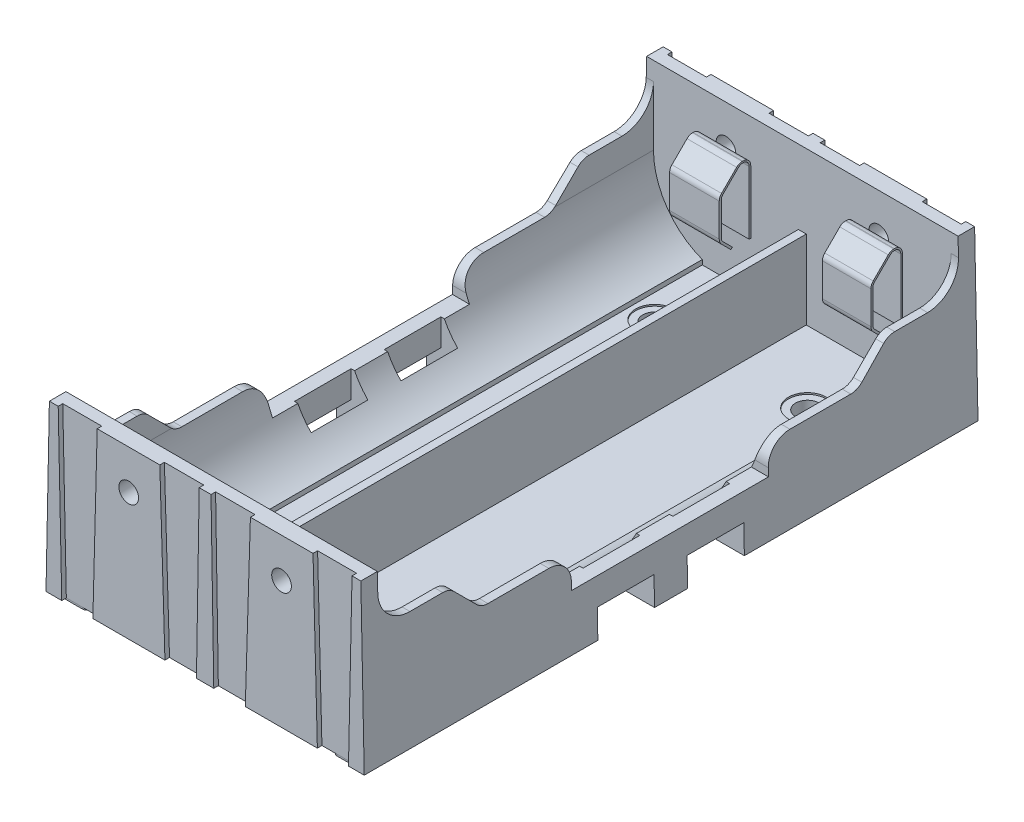
from build123d import *

# Parameters (mm, degrees)
BOSS_EXTRU_1_DEPTH                  = 73.72
BOSS_EXTRU_2_DEPTH                  = 2.1
BOSS_EXTRU_3_DEPTH                  = 2.1
CONG_1_R                            = 4
ENL_V_MAT_EXTRU_1_REACH             = 103.263
ENL_V_START                         = 20
ENL_V_MAT_EXTRU_1_DIRECTION_2_DEPTH = 82.262611329
ENL_V_START_2                       = -20.058108
ENL_V_MAT_EXTRU_2_DEPTH             = 2.167345
ENL_V_START_3                       = 16.2
ESQUISSE6_W                         = 7.2
ESQUISSE6_H                         = 7.148183782
ENL_V_MAT_EXTRU_3_DEPTH             = 4
ENL_V_START_4                       = -20.2
ESQUISSE6_2_W                       = 7.2
ESQUISSE6_2_H                       = 7.148183782
ENL_V_MAT_EXTRU_4_DEPTH             = 4
ESQUISSE7_W                         = 2.127027027
ESQUISSE7_H                         = 7.2
ENL_V_MAT_EXTRU_5_DEPTH             = 82.262611329
CONG_2_R                            = 2
CONG_3_R                            = 2.8
ESQUISSE8_R                         = 3
BOSS_EXTRU_4_DEPTH                  = 0.22
ESQUISSE9_R                         = 1.5
ENL_V_MAT_EXTRU_6_DEPTH             = 82.320120511
ENL_V_MAT_EXTRU_7_DEPTH             = 0.58
ENL_V_START_5                       = -77.92
ENL_V_MAT_EXTRU_8_DEPTH             = 0.58
ESQUISSE11_R                        = 2.4
ENL_V_MAT_EXTRU_9_DEPTH             = 0.2
BOSS_EXTRU_5_START                  = 6
ESQUISSE12_W                        = 6.3
ESQUISSE12_H                        = 4
ESQUISSE12_W_2                      = 6.15
BOSS_EXTRU_5_DEPTH                  = 9
CHANFREIN1_SIZE                     = 2.5
CHANFREIN2_SIZE                     = 1.5
CONG_4_R                            = 1
ENL_V_MAT_EXTRU_10_REACH            = 87.311
ENL_V_START_6                       = -25.55
ENL_V_MAT_EXTRU_11_DEPTH            = 6.3
ESQUISSE14_R                        = 1.25
ENL_V_MAT_EXTRU_12_DEPTH            = 2.1
ESQUISSE14_2_R                      = 1.25
ENL_V_MAT_EXTRU_13_DEPTH            = 2.1


with BuildPart() as part:
    # Esquisse1 → Boss.-Extru.1 (new body)
    with BuildSketch(Plane.XY):
        with BuildLine():
            Line((-19.9, 14.8), (-20.2, 0))
            Line((-20.2, 0), (0, 0))
            Line((0, 0), (0, 11.74))
            Line((0, 11.74), (-0.5, 11.74))
            Line((-0.5, 11.74), (-0.5, 1.74))
            Line((-0.5, 1.74), (-12.7, 1.74))
            Line((-12.7, 1.74), (-12.7, 2.34))
            ThreePointArc((-12.7, 2.34), (-17.19797428, 5.832963152), (-18.9, 11.267636339))
            Line((-18.9, 11.267636339), (-18.9, 14.8))
            Line((-18.9, 14.8), (-19.9, 14.8))
        make_face()
        with BuildLine():
            Line((0, 11.74), (0, 0))
            Line((0, 0), (20.2, 0))
            Line((20.2, 0), (19.9, 14.8))
            Line((19.9, 14.8), (18.9, 14.8))
            Line((18.9, 14.8), (18.9, 11.267636339))
            ThreePointArc((18.9, 11.267636339), (17.19797428, 5.832963152), (12.7, 2.34))
            Line((12.7, 2.34), (12.7, 1.74))
            Line((12.7, 1.74), (0.5, 1.74))
            Line((0.5, 1.74), (0.5, 11.74))
            Line((0.5, 11.74), (0, 11.74))
        make_face()
    extrude(amount=BOSS_EXTRU_1_DEPTH)

    # Esquisse2 → Boss.-Extru.2 (add)
    with BuildSketch(Plane.XY.offset(73.72)):
        Polygon((-20.2, 0), (20.2, 0), (19.771486486, 21.14), (-19.771486486, 21.14), align=None)
    extrude(amount=BOSS_EXTRU_2_DEPTH)

    # Esquisse3 → Boss.-Extru.3 (add)
    with BuildSketch(Plane(origin=(0, 0, 0), x_dir=(-1, 0, 0), z_dir=(0, 0, -1))):
        Polygon((-20.2, 0), (20.2, 0), (19.771486486, 21.14), (-19.771486486, 21.14), align=None)
    extrude(amount=BOSS_EXTRU_3_DEPTH)

    # Congé1
    cong_1_edges = [part.edges().sort_by_distance(p)[0] for p in [
        (19.4, 14.8, 0),
        (-19.4, 14.8, 0),
        (-19.4, 14.8, 73.72),
        (19.4, 14.8, 73.72),
    ]]
    fillet(cong_1_edges, radius=CONG_1_R)

    # Esquisse4 → Enlèv. mat.-Extru.1 (cut, up to next)
    with BuildSketch(Plane(origin=(0, 0, 0), x_dir=(0, 0, -1), z_dir=(1, 0, 0)).offset(ENL_V_START), mode=Mode.PRIVATE) as enl_v_mat_extru_1_sk1:
        Polygon((-64.72, 14.8), (-60.72, 10.8), (-49.36, 10.8), (-49.36, 7), (-24.36, 7), (-24.36, 10.8), (-13, 10.8), (-9, 14.8), align=None)
    enl_v_mat_extru_1_tool1 = extrude(enl_v_mat_extru_1_sk1.sketch, amount=-ENL_V_MAT_EXTRU_1_REACH, mode=Mode.PRIVATE) & part.part
    add(enl_v_mat_extru_1_tool1.solids().sort_by_distance((20, 11.608025, 36.86))[0], mode=Mode.SUBTRACT)

    # Esquisse4 → Enlèv. mat.-Extru.1 direction 2 (cut)
    with BuildSketch(Plane(origin=(0, 0, 0), x_dir=(0, 0, -1), z_dir=(1, 0, 0)).offset(ENL_V_START)):
        Polygon((-64.72, 14.8), (-60.72, 10.8), (-49.36, 10.8), (-49.36, 7), (-24.36, 7), (-24.36, 10.8), (-13, 10.8), (-9, 14.8), align=None)
    extrude(amount=ENL_V_MAT_EXTRU_1_DIRECTION_2_DEPTH, mode=Mode.SUBTRACT)

    # Esquisse4<2> → Enlèv. mat.-Extru.2 (cut)
    with BuildSketch(Plane(origin=(0, 0, 0), x_dir=(0, 0, -1), z_dir=(1, 0, 0)).offset(ENL_V_START_2)):
        Polygon((-64.72, 14.8), (-60.72, 10.8), (-49.36, 10.8), (-49.36, 7), (-24.36, 7), (-24.36, 10.8), (-13, 10.8), (-9, 14.8), align=None)
    extrude(amount=ENL_V_MAT_EXTRU_2_DEPTH, mode=Mode.SUBTRACT)

    # Esquisse6 → Enlèv. mat.-Extru.3 (cut)
    with BuildSketch(Plane(origin=(0, 0, 0), x_dir=(0, 0, -1), z_dir=(1, 0, 0)).offset(ENL_V_START_3)):
        with Locations((-42.56, 0.025908109)):
            Rectangle(ESQUISSE6_W, ESQUISSE6_H)
        with Locations((-31.16, 0.025908109)):
            Rectangle(ESQUISSE6_W, ESQUISSE6_H)
    extrude(amount=ENL_V_MAT_EXTRU_3_DEPTH, mode=Mode.SUBTRACT)

    # Esquisse6<2> → Enlèv. mat.-Extru.4 (cut)
    with BuildSketch(Plane(origin=(0, 0, 0), x_dir=(0, 0, -1), z_dir=(1, 0, 0)).offset(ENL_V_START_4)):
        with Locations((-42.56, 0.025908109)):
            Rectangle(ESQUISSE6_2_W, ESQUISSE6_2_H)
        with Locations((-31.16, 0.025908109)):
            Rectangle(ESQUISSE6_2_W, ESQUISSE6_2_H)
    extrude(amount=ENL_V_MAT_EXTRU_4_DEPTH, mode=Mode.SUBTRACT)

    # Esquisse7 → Enlèv. mat.-Extru.5 (cut, through all)
    with BuildSketch(Plane.XZ):
        with Locations((17.263513514, 42.56)):
            Rectangle(ESQUISSE7_W, ESQUISSE7_H)
        with Locations((-17.263513514, 42.56)):
            Rectangle(ESQUISSE7_W, ESQUISSE7_H)
        with Locations((17.263513514, 31.16)):
            Rectangle(ESQUISSE7_W, ESQUISSE7_H)
        with Locations((-17.263513514, 31.16)):
            Rectangle(ESQUISSE7_W, ESQUISSE7_H)
    extrude(amount=-ENL_V_MAT_EXTRU_5_DEPTH, mode=Mode.SUBTRACT)

    # Congé2
    cong_2_edges = [part.edges().sort_by_distance(p)[0] for p in [
        (-19.4, 14.8, 9),
        (19.4, 14.8, 9),
        (19.4, 14.8, 64.72),
        (-19.4, 14.8, 64.72),
        (-19.434798938, 10.8, 60.72),
        (19.434798938, 10.8, 60.72),
        (19.434798938, 10.8, 13),
        (-19.434798938, 10.8, 13),
    ]]
    fillet(cong_2_edges, radius=CONG_2_R)

    # Congé3
    cong_3_edges = [part.edges().sort_by_distance(p)[0] for p in [
        (19.434798938, 10.8, 49.36),
        (19.434798938, 10.8, 24.36),
        (-19.434798938, 10.8, 24.36),
        (-19.434798938, 10.8, 49.36),
    ]]
    fillet(cong_3_edges, radius=CONG_3_R)

    # Esquisse8 → Boss.-Extru.4 (add)
    with BuildSketch(Plane.XZ):
        with Locations(Location((-9.7, 64.66, 0), (0, 0, 90))):
            Circle(ESQUISSE8_R)
        with Locations(Location((9.7, 64.66, 0), (0, 0, 90))):
            Circle(ESQUISSE8_R)
        with Locations(Location((9.7, 9.06, 0), (0, 0, 90))):
            Circle(ESQUISSE8_R)
        with Locations(Location((-9.7, 9.06, 0), (0, 0, 90))):
            Circle(ESQUISSE8_R)
        with BuildLine():
            Line((-19.1, 75.22), (-16.16, 75.22))
            ThreePointArc((-16.16, 75.22), (-15.66, 74.72), (-16.16, 74.22))
            Line((-16.16, 74.22), (-18.5, 74.22))
            ThreePointArc((-18.5, 74.22), (-18.570710678, 74.190710678), (-18.6, 74.12))
            Line((-18.6, 74.12), (-18.6, 73.42))
            ThreePointArc((-18.6, 73.42), (-19.1, 72.92), (-19.6, 73.42))
            Line((-19.6, 73.42), (-19.6, 74.72))
            ThreePointArc((-19.6, 74.72), (-19.453553391, 75.073553391), (-19.1, 75.22))
        make_face()
        with BuildLine():
            Line((18.6, 73.42), (18.6, 74.12))
            ThreePointArc((18.6, 74.12), (18.570710678, 74.190710678), (18.5, 74.22))
            Line((18.5, 74.22), (16.16, 74.22))
            ThreePointArc((16.16, 74.22), (15.66, 74.72), (16.16, 75.22))
            Line((16.16, 75.22), (19.1, 75.22))
            ThreePointArc((19.1, 75.22), (19.453553391, 75.073553391), (19.6, 74.72))
            Line((19.6, 74.72), (19.6, 73.42))
            ThreePointArc((19.6, 73.42), (19.1, 72.92), (18.6, 73.42))
        make_face()
        with BuildLine():
            Line((19.1, -1.5), (16.16, -1.5))
            ThreePointArc((16.16, -1.5), (15.66, -1), (16.16, -0.5))
            Line((16.16, -0.5), (18.5, -0.5))
            ThreePointArc((18.5, -0.5), (18.570710678, -0.470710678), (18.6, -0.4))
            Line((18.6, -0.4), (18.6, 0.3))
            ThreePointArc((18.6, 0.3), (19.1, 0.8), (19.6, 0.3))
            Line((19.6, 0.3), (19.6, -1))
            ThreePointArc((19.6, -1), (19.453553391, -1.353553391), (19.1, -1.5))
        make_face()
        with BuildLine():
            Line((-18.6, 0.3), (-18.6, -0.4))
            ThreePointArc((-18.6, -0.4), (-18.570710678, -0.470710678), (-18.5, -0.5))
            Line((-18.5, -0.5), (-16.16, -0.5))
            ThreePointArc((-16.16, -0.5), (-15.66, -1), (-16.16, -1.5))
            Line((-16.16, -1.5), (-19.1, -1.5))
            ThreePointArc((-19.1, -1.5), (-19.453553391, -1.353553391), (-19.6, -1))
            Line((-19.6, -1), (-19.6, 0.3))
            ThreePointArc((-19.6, 0.3), (-19.1, 0.8), (-18.6, 0.3))
        make_face()
    extrude(amount=BOSS_EXTRU_4_DEPTH)

    # Esquisse9 → Enlèv. mat.-Extru.6 (cut, through all)
    with BuildSketch(Plane(origin=(0, -0.22, 0), x_dir=(-1, 0, 0), z_dir=(0, -1, 0))):
        with Locations(Location((9.7, -64.66, 0), (0, 0, 90))):
            Circle(ESQUISSE9_R)
        with Locations(Location((-9.7, -64.66, 0), (0, 0, 180))):
            Circle(ESQUISSE9_R)
        with Locations(Location((-9.7, -9.06, 0), (0, 0, 90))):
            Circle(ESQUISSE9_R)
        with Locations((9.7, -9.06)):
            Circle(ESQUISSE9_R)
    extrude(amount=-ENL_V_MAT_EXTRU_6_DEPTH, mode=Mode.SUBTRACT)

    # Esquisse10 → Enlèv. mat.-Extru.7 (cut)
    with BuildSketch(Plane.XY.offset(75.82)):
        Polygon((-0.75, 21.14), (-1.1, 0), (-5.1, 0), (-5.75, 21.14), align=None)
        Polygon((-18.65, 21.14), (-18.2, 0), (-14.25, 0), (-13.7, 21.14), align=None)
        Polygon((5.1, 0), (1.1, 0), (0.75, 21.14), (5.75, 21.14), align=None)
        Polygon((18.2, 0), (14.25, 0), (13.7, 21.14), (18.65, 21.14), align=None)
    extrude(amount=-ENL_V_MAT_EXTRU_7_DEPTH, mode=Mode.SUBTRACT)

    # Esquisse10<2> → Enlèv. mat.-Extru.8 (cut)
    with BuildSketch(Plane.XY.offset(75.82).offset(ENL_V_START_5)):
        Polygon((-0.75, 21.14), (-1.1, 0), (-5.1, 0), (-5.75, 21.14), align=None)
        Polygon((-18.65, 21.14), (-18.2, 0), (-14.25, 0), (-13.7, 21.14), align=None)
        Polygon((5.1, 0), (1.1, 0), (0.75, 21.14), (5.75, 21.14), align=None)
        Polygon((18.2, 0), (14.25, 0), (13.7, 21.14), (18.65, 21.14), align=None)
    extrude(amount=ENL_V_MAT_EXTRU_8_DEPTH, mode=Mode.SUBTRACT)

    # Esquisse11 → Enlèv. mat.-Extru.9 (cut)
    with BuildSketch(Plane(origin=(0, 1.74, 0), x_dir=(1, 0, 0), z_dir=(0, 1, 0))):
        with Locations(Location((-9.7, -9.06, 0), (0, 0, 180))):
            Circle(ESQUISSE11_R)
        with Locations(Location((9.7, -9.06, 0), (0, 0, 180))):
            Circle(ESQUISSE11_R)
        with Locations(Location((9.7, -64.66, 0), (0, 0, 180))):
            Circle(ESQUISSE11_R)
        with Locations(Location((-9.7, -64.66, 0), (0, 0, 180))):
            Circle(ESQUISSE11_R)
    extrude(amount=-ENL_V_MAT_EXTRU_9_DEPTH, mode=Mode.SUBTRACT)

    # Esquisse12 → Boss.-Extru.5 (add)
    with BuildSketch(Plane(origin=(0, 1.74, 0), x_dir=(1, 0, 0), z_dir=(0, 1, 0)).offset(BOSS_EXTRU_5_START)):
        with Locations((-9.7, -71.72)):
            Rectangle(ESQUISSE12_W, ESQUISSE12_H)
        with Locations((9.625, -71.72)):
            Rectangle(ESQUISSE12_W_2, ESQUISSE12_H)
        with Locations((9.625, -2)):
            Rectangle(ESQUISSE12_W_2, ESQUISSE12_H)
        with Locations((-9.7, -2)):
            Rectangle(ESQUISSE12_W, ESQUISSE12_H)
    extrude(amount=BOSS_EXTRU_5_DEPTH)

    # Chanfrein1
    chanfrein1_edges = [part.edges().sort_by_distance(p)[0] for p in [
        (-9.7, 16.74, 69.72),
        (9.625, 16.74, 69.72),
        (9.625, 16.74, 4),
        (-9.7, 16.74, 4),
    ]]
    chamfer(chanfrein1_edges, length=CHANFREIN1_SIZE)

    # Chanfrein2
    chanfrein2_edges = [part.edges().sort_by_distance(p)[0] for p in [
        (-9.7, 7.74, 69.72),
        (9.625, 7.74, 69.72),
        (9.625, 7.74, 4),
        (-9.7, 7.74, 4),
    ]]
    chamfer(chanfrein2_edges, length=CHANFREIN2_SIZE)

    # Congé4
    cong_4_edges = [part.edges().sort_by_distance(p)[0] for p in [
        (-9.7, 14.24, 4),
        (-9.7, 16.74, 1.5),
        (9.625, 16.74, 1.5),
        (9.625, 14.24, 4),
        (9.625, 14.24, 69.72),
        (9.625, 16.74, 72.22),
        (-9.7, 16.74, 72.22),
        (-9.7, 14.24, 69.72),
        (9.625, 9.24, 4),
        (-9.7, 9.24, 4),
        (-9.7, 9.24, 69.72),
        (9.625, 9.24, 69.72),
    ]]
    fillet(cong_4_edges, radius=CONG_4_R)

    # Esquisse13 → Enlèv. mat.-Extru.10 (cut, up to next)
    with BuildSketch(Plane(origin=(12.7, 0, 0), x_dir=(0, 0, -1), z_dir=(1, 0, 0)), mode=Mode.PRIVATE) as enl_v_mat_extru_10_sk1:
        with BuildLine():
            Line((-72.72, 16.74), (-72.72, 17.106019535))
            Line((-72.72, 17.106019535), (-73.72, 17.106019535))
            Line((-73.72, 17.106019535), (-73.72, 15.74))
            ThreePointArc((-73.72, 15.74), (-73.427106781, 16.447106781), (-72.72, 16.74))
        make_face()
    enl_v_mat_extru_10_tool1 = extrude(enl_v_mat_extru_10_sk1.sketch, amount=-ENL_V_MAT_EXTRU_10_REACH, mode=Mode.PRIVATE) & part.part
    # Esquisse13 → Enlèv. mat.-Extru.10 (cut, up to next)
    with BuildSketch(Plane(origin=(12.7, 0, 0), x_dir=(0, 0, -1), z_dir=(1, 0, 0)), mode=Mode.PRIVATE) as enl_v_mat_extru_10_sk2:
        with BuildLine():
            Line((-70.197207794, 14.348578644), (-72.154314575, 16.305685425))
            ThreePointArc((-72.154314575, 16.305685425), (-73.026146746, 16.479103626), (-73.52, 15.74))
            Line((-73.52, 15.74), (-73.52, 6.535067032))
            Line((-73.52, 6.535067032), (-72.553577604, 6.535067032))
            Line((-72.553577604, 6.535067032), (-70.870571572, 7.428556502))
            Line((-70.870571572, 7.428556502), (-71.38532211, 7.94330704))
            Line((-71.38532211, 7.94330704), (-70.197207794, 9.131421356))
            ThreePointArc((-70.197207794, 9.131421356), (-70.036939065, 9.371280459), (-69.980660172, 9.654213562))
            Line((-69.980660172, 9.654213562), (-69.980660172, 13.825786438))
            ThreePointArc((-69.980660172, 13.825786438), (-70.036939065, 14.108719541), (-70.197207794, 14.348578644))
        make_face()
    enl_v_mat_extru_10_tool2 = extrude(enl_v_mat_extru_10_sk2.sketch, amount=-ENL_V_MAT_EXTRU_10_REACH, mode=Mode.PRIVATE) & part.part
    # Esquisse13 → Enlèv. mat.-Extru.10 (cut, up to next)
    with BuildSketch(Plane(origin=(12.7, 0, 0), x_dir=(0, 0, -1), z_dir=(1, 0, 0)), mode=Mode.PRIVATE) as enl_v_mat_extru_10_sk3:
        with BuildLine():
            Line((-0.2, 6.535067032), (-1.166422396, 6.535067032))
            Line((-1.166422396, 6.535067032), (-2.849428428, 7.428556502))
            Line((-2.849428428, 7.428556502), (-2.33467789, 7.94330704))
            Line((-2.33467789, 7.94330704), (-3.522792206, 9.131421356))
            ThreePointArc((-3.522792206, 9.131421356), (-3.683060935, 9.371280459), (-3.739339828, 9.654213562))
            Line((-3.739339828, 9.654213562), (-3.739339828, 13.825786438))
            ThreePointArc((-3.739339828, 13.825786438), (-3.683060935, 14.108719541), (-3.522792206, 14.348578644))
            Line((-3.522792206, 14.348578644), (-1.565685425, 16.305685425))
            ThreePointArc((-1.565685425, 16.305685425), (-0.693853254, 16.479103626), (-0.2, 15.74))
            Line((-0.2, 15.74), (-0.2, 6.535067032))
        make_face()
    enl_v_mat_extru_10_tool3 = extrude(enl_v_mat_extru_10_sk3.sketch, amount=-ENL_V_MAT_EXTRU_10_REACH, mode=Mode.PRIVATE) & part.part
    # Esquisse13 → Enlèv. mat.-Extru.10 (cut, up to next)
    with BuildSketch(Plane(origin=(12.7, 0, 0), x_dir=(0, 0, -1), z_dir=(1, 0, 0)), mode=Mode.PRIVATE) as enl_v_mat_extru_10_sk4:
        with BuildLine():
            Line((0, 17.106019535), (0, 15.74))
            ThreePointArc((0, 15.74), (-0.292893219, 16.447106781), (-1, 16.74))
            Line((-1, 16.74), (-1, 17.106019535))
            Line((-1, 17.106019535), (0, 17.106019535))
        make_face()
    enl_v_mat_extru_10_tool4 = extrude(enl_v_mat_extru_10_sk4.sketch, amount=-ENL_V_MAT_EXTRU_10_REACH, mode=Mode.PRIVATE) & part.part
    add(enl_v_mat_extru_10_tool1.solids().sort_by_distance((12.7, 16.77281, 73.322245))[0], mode=Mode.SUBTRACT)
    add(enl_v_mat_extru_10_tool2.solids().sort_by_distance((12.7, 11.523685, 71.952093))[0], mode=Mode.SUBTRACT)
    add(enl_v_mat_extru_10_tool3.solids().sort_by_distance((12.7, 11.523685, 1.767907))[0], mode=Mode.SUBTRACT)
    add(enl_v_mat_extru_10_tool4.solids().sort_by_distance((12.7, 16.77281, 0.397755))[0], mode=Mode.SUBTRACT)

    # Esquisse13<3> → Enlèv. mat.-Extru.11 (cut)
    with BuildSketch(Plane(origin=(12.7, 0, 0), x_dir=(0, 0, -1), z_dir=(1, 0, 0)).offset(ENL_V_START_6)):
        with BuildLine():
            Line((-72.72, 16.74), (-72.72, 17.106019535))
            Line((-72.72, 17.106019535), (-73.72, 17.106019535))
            Line((-73.72, 17.106019535), (-73.72, 15.74))
            ThreePointArc((-73.72, 15.74), (-73.427106781, 16.447106781), (-72.72, 16.74))
        make_face()
        with BuildLine():
            Line((-70.197207794, 14.348578644), (-72.154314575, 16.305685425))
            ThreePointArc((-72.154314575, 16.305685425), (-73.026146746, 16.479103626), (-73.52, 15.74))
            Line((-73.52, 15.74), (-73.52, 6.535067032))
            Line((-73.52, 6.535067032), (-72.553577604, 6.535067032))
            Line((-72.553577604, 6.535067032), (-70.870571572, 7.428556502))
            Line((-70.870571572, 7.428556502), (-71.38532211, 7.94330704))
            Line((-71.38532211, 7.94330704), (-70.197207794, 9.131421356))
            ThreePointArc((-70.197207794, 9.131421356), (-70.036939065, 9.371280459), (-69.980660172, 9.654213562))
            Line((-69.980660172, 9.654213562), (-69.980660172, 13.825786438))
            ThreePointArc((-69.980660172, 13.825786438), (-70.036939065, 14.108719541), (-70.197207794, 14.348578644))
        make_face()
        with BuildLine():
            Line((-0.2, 6.535067032), (-1.166422396, 6.535067032))
            Line((-1.166422396, 6.535067032), (-2.849428428, 7.428556502))
            Line((-2.849428428, 7.428556502), (-2.33467789, 7.94330704))
            Line((-2.33467789, 7.94330704), (-3.522792206, 9.131421356))
            ThreePointArc((-3.522792206, 9.131421356), (-3.683060935, 9.371280459), (-3.739339828, 9.654213562))
            Line((-3.739339828, 9.654213562), (-3.739339828, 13.825786438))
            ThreePointArc((-3.739339828, 13.825786438), (-3.683060935, 14.108719541), (-3.522792206, 14.348578644))
            Line((-3.522792206, 14.348578644), (-1.565685425, 16.305685425))
            ThreePointArc((-1.565685425, 16.305685425), (-0.693853254, 16.479103626), (-0.2, 15.74))
            Line((-0.2, 15.74), (-0.2, 6.535067032))
        make_face()
        with BuildLine():
            Line((0, 17.106019535), (0, 15.74))
            ThreePointArc((0, 15.74), (-0.292893219, 16.447106781), (-1, 16.74))
            Line((-1, 16.74), (-1, 17.106019535))
            Line((-1, 17.106019535), (0, 17.106019535))
        make_face()
    extrude(amount=ENL_V_MAT_EXTRU_11_DEPTH, mode=Mode.SUBTRACT)

    # Esquisse14 → Enlèv. mat.-Extru.12 (cut)
    with BuildSketch(Plane(origin=(0, 0, -2.1), x_dir=(-1, 0, 0), z_dir=(0, 0, -1))):
        with Locations((9.7, 16.14)):
            Circle(ESQUISSE14_R)
        with Locations(Location((-9.7, 16.14, 0), (0, 0, 341.337075115))):
            Circle(ESQUISSE14_R)
    extrude(amount=-ENL_V_MAT_EXTRU_12_DEPTH, mode=Mode.SUBTRACT)

    # Esquisse14<2> → Enlèv. mat.-Extru.13 (cut)
    with BuildSketch(Plane(origin=(0, 0, -2.1), x_dir=(-1, 0, 0), z_dir=(0, 0, -1)).offset(ENL_V_START_5)):
        with Locations((9.7, 16.14)):
            Circle(ESQUISSE14_2_R)
        with Locations(Location((-9.7, 16.14, 0), (0, 0, 341.337075115))):
            Circle(ESQUISSE14_2_R)
    extrude(amount=ENL_V_MAT_EXTRU_13_DEPTH, mode=Mode.SUBTRACT)


solid = part.part
